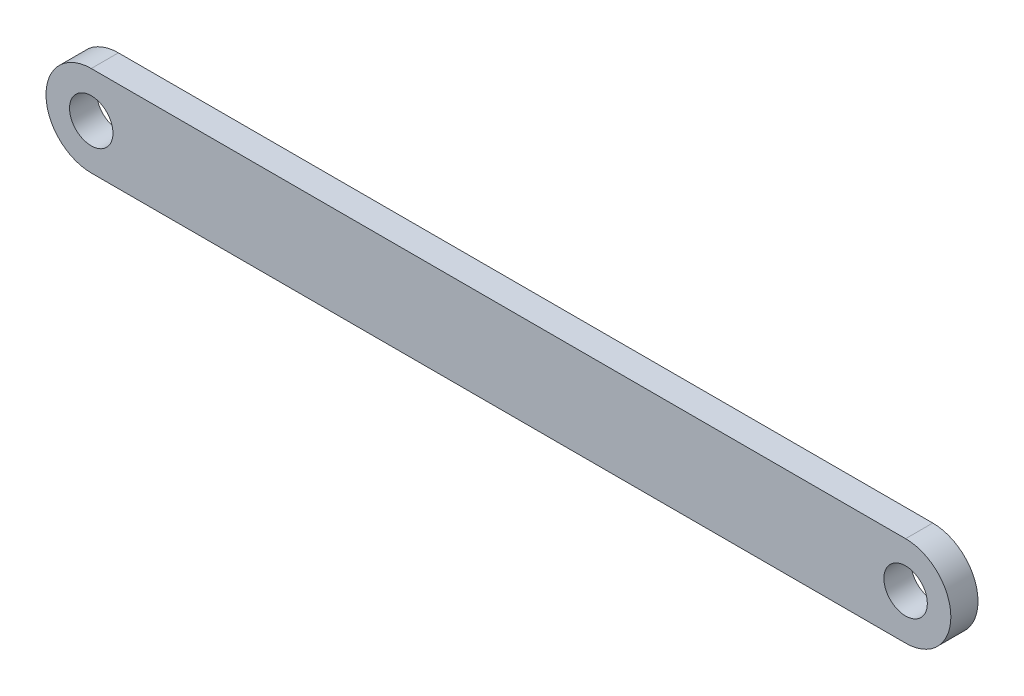
from build123d import *

# Parameters (mm, degrees)
SKETCH1_R           = 2.4
BOSS_EXTRUDE1_DEPTH = 3


with BuildPart() as part:
    # Sketch1 → Boss-Extrude1 (new body)
    with BuildSketch(Plane.XY):
        with BuildLine():
            Line((120.078651701, 190.032322866), (210.078651701, 190.032322866))
            ThreePointArc((210.078651701, 190.032322866), (215.078651701, 195.032322866), (210.078651701, 200.032322866))
            Line((210.078651701, 200.032322866), (120.078651701, 200.032322866))
            ThreePointArc((120.078651701, 200.032322866), (115.078651701, 195.032322866), (120.078651701, 190.032322866))
        make_face()
        with Locations((120.078651701, 195.032322866)):
            Circle(SKETCH1_R, mode=Mode.SUBTRACT)
        with Locations((210.078651701, 195.032322866)):
            Circle(SKETCH1_R, mode=Mode.SUBTRACT)
    extrude(amount=BOSS_EXTRUDE1_DEPTH)


solid = part.part
